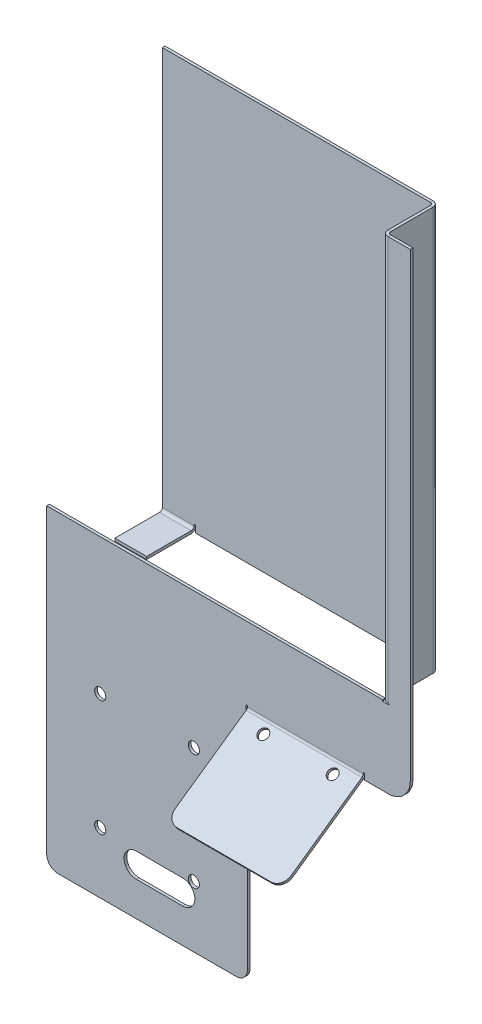
from build123d import *

# Parameters (mm, degrees)
BASE_FLANGE1_DEPTH            = 1.21412
SKETCH19_W                    = 150.565156201
SKETCH19_H                    = 181.162980563
CUT_EXTRUDE2_DEPTH            = 5
EDGE_FLANGE5_START            = 106.282964216
EDGE_FLANGE5_DEPTH            = 181.770040563
EDGE_FLANGE5_2_DEPTH          = 0.60706
EDGE_FLANGE5_START_2          = 106.890024216
EDGE_FLANGE5_3_DEPTH          = 181.162980563
EDGE_FLANGE6_STRIP_W          = 7.39648
EDGE_FLANGE6_STRIP_H          = 1.21412
EDGE_FLANGE6_STRIP_CUT_DEPTH  = 181.162980563
EDGE_FLANGE6_DEPTH            = 181.162980563
EDGE_FLANGE7_STRIP_W          = 7.39648
EDGE_FLANGE7_STRIP_H          = 1.21412
EDGE_FLANGE7_STRIP_CUT_DEPTH  = 14.216886025
EDGE_FLANGE7_RELIEF_W         = 8.00354
EDGE_FLANGE7_RELIEF_H         = 0.60706
EDGE_FLANGE7_RELIEF_CUT_DEPTH = 1.21412
EDGE_FLANGE7_DEPTH            = 14.216886025
SKETCH29_R                    = 2.5
CUT_EXTRUDE3_DEPTH            = 5
EDGE_FLANGE8_START            = -92.476413081
EDGE_FLANGE8_DEPTH            = 53.21412
EDGE_FLANGE8_2_DEPTH          = 0.60706
EDGE_FLANGE8_START_2          = -39.869353081
EDGE_FLANGE8_3_DEPTH          = 0.60706
EDGE_FLANGE8_START_3          = -91.869353081
EDGE_FLANGE8_4_DEPTH          = 52
EDGE_FLANGE8_START_4          = 58
EDGE_FLANGE8_5_DEPTH          = 2.895111402
SKETCH34_R                    = 2.25
CUT_EXTRUDE6_DEPTH            = 10


with BuildPart() as part:
    # Base-Flange1: sheet metal written as solids
    # Sketch1 → Base-Flange1 (new body)
    with BuildSketch(Plane.XY):
        with BuildLine():
            Line((-96.869353081, -33.474110531), (-176.869353081, -33.474110531))
            ThreePointArc((-176.869353081, -33.474110531), (-180.404886987, -32.009644437), (-181.869353081, -28.474110531))
            Line((-181.869353081, -28.474110531), (-181.869353081, 288.053004779))
            Line((-181.869353081, 288.053004779), (-18.770502539, 288.053004779))
            Line((-18.770502539, 288.053004779), (-18.770502539, 81.588857582))
            ThreePointArc((-18.770502539, 81.588857582), (-21.699434728, 74.51778977), (-28.770502539, 71.588857582))
            Line((-28.770502539, 71.588857582), (-91.869353081, 71.588857582))
            Line((-91.869353081, 71.588857582), (-91.869353081, -28.474110531))
            ThreePointArc((-91.869353081, -28.474110531), (-93.333819175, -32.009644437), (-96.869353081, -33.474110531))
        make_face()
    extrude(amount=-BASE_FLANGE1_DEPTH)

    # Sketch19 → Cut-Extrude2 (cut)
    with BuildSketch(Plane(origin=(0, 0, -1.21412), x_dir=(-1, 0, 0), z_dir=(0, 0, -1))):
        with Locations((106.586774981, 197.471514497)):
            Rectangle(SKETCH19_W, SKETCH19_H)
    extrude(amount=-CUT_EXTRUDE2_DEPTH, mode=Mode.SUBTRACT)

    # Edge-Flange5: read off the stored shape, not the designer's step
    # Edge-Flange5 outline → Edge-Flange5 (cut)
    with BuildSketch(Plane(origin=(0, 0, 0), x_dir=(1, 0, 0), z_dir=(0, 1, 0)).offset(EDGE_FLANGE5_START)):
        with BuildLine():
            Line((-31.30419688, 0), (-28.82007688, 0))
            ThreePointArc((-28.82007688, 0), (-30.04808742, 0.324758454), (-30.955012985, 1.21412))
            Line((-30.955012985, 1.21412), (-31.30419688, 1.21412))
            Line((-31.30419688, 1.21412), (-31.30419688, 0))
        make_face()
    extrude(amount=EDGE_FLANGE5_DEPTH, mode=Mode.SUBTRACT)

    # Edge-Flange5 2 outline → Edge-Flange5 2 (cut)
    with BuildSketch(Plane(origin=(0, 0, 0), x_dir=(1, 0, 0), z_dir=(0, 1, 0)).offset(EDGE_FLANGE5_START)):
        with BuildLine():
            Line((-28.21301688, 0), (-28.21301688, 1.21412))
            Line((-28.21301688, 1.21412), (-30.955012985, 1.21412))
            ThreePointArc((-30.955012985, 1.21412), (-30.04808742, 0.324758454), (-28.82007688, 0))
            Line((-28.82007688, 0), (-28.21301688, 0))
        make_face()
    extrude(amount=EDGE_FLANGE5_2_DEPTH, mode=Mode.SUBTRACT)

    # Edge-Flange5 3 outline → Edge-Flange5 3 (add)
    with BuildSketch(Plane(origin=(0, 0, 0), x_dir=(1, 0, 0), z_dir=(0, 1, 0)).offset(EDGE_FLANGE5_START_2)):
        with BuildLine():
            Line((-30.955012985, 1.21412), (-28.82007688, 1.21412))
            ThreePointArc((-28.82007688, 1.21412), (-29.718102492, 1.586094388), (-30.09007688, 2.48412))
            Line((-30.09007688, 2.48412), (-30.09007688, 24))
            Line((-30.09007688, 24), (-31.30419688, 24))
            Line((-31.30419688, 24), (-31.30419688, 2.48412))
            ThreePointArc((-31.30419688, 2.48412), (-31.215310653, 1.825555388), (-30.955012985, 1.21412))
        make_face()
    extrude(amount=EDGE_FLANGE5_3_DEPTH)

    # Edge-Flange6: sheet metal written as solids
    # Edge-Flange6 strip (on a plane across the edge) → Edge-Flange6 strip cut (cut)
    with BuildSketch(Plane(origin=(-31.30419688, 288.053004779, -24), x_dir=(0, 0, 1), z_dir=(0, -1, 0))):
        with Locations((-1.21412, -0.60706)):
            Rectangle(EDGE_FLANGE6_STRIP_W, EDGE_FLANGE6_STRIP_H)
    extrude(amount=EDGE_FLANGE6_STRIP_CUT_DEPTH, mode=Mode.SUBTRACT)

    # Edge-Flange6 section (on a plane across the edge) → Edge-Flange6 (add)
    with BuildSketch(Plane(origin=(-31.30419688, 288.053004779, -24), x_dir=(0, 0, 1), z_dir=(0, -1, 0))):
        with BuildLine():
            Line((0, 1.27), (0, 121.48412))
            Line((0, 121.48412), (1.21412, 121.48412))
            Line((1.21412, 121.48412), (1.21412, 1.27))
            ThreePointArc((1.21412, 1.27), (1.586094388, 0.371974388), (2.48412, 0))
            Line((2.48412, 0), (2.48412, -1.21412))
            ThreePointArc((2.48412, -1.21412), (0.727581903, -0.486538097), (0, 1.27))
        make_face()
    extrude(amount=EDGE_FLANGE6_DEPTH)

    # Edge-Flange7: sheet metal written as solids
    # Edge-Flange7 strip (on a plane across the edge) → Edge-Flange7 strip cut (cut)
    with BuildSketch(Plane(origin=(-152.78831688, 106.890024216, -22.78588), x_dir=(0, 1, 0), z_dir=(1, 0, 0))):
        with Locations((-1.21412, -0.60706)):
            Rectangle(EDGE_FLANGE7_STRIP_W, EDGE_FLANGE7_STRIP_H)
    extrude(amount=EDGE_FLANGE7_STRIP_CUT_DEPTH, mode=Mode.SUBTRACT)

    # Edge-Flange7 relief (on the sheet) → Edge-Flange7 relief cut (cut)
    with BuildSketch(Plane(origin=(-152.78831688, 109.374144216, -22.78588), x_dir=(0, 1, 0), z_dir=(0, 0, 1))):
        with Locations((-3.39471, -14.520416025)):
            Rectangle(EDGE_FLANGE7_RELIEF_W, EDGE_FLANGE7_RELIEF_H)
    extrude(amount=-EDGE_FLANGE7_RELIEF_CUT_DEPTH, mode=Mode.SUBTRACT)

    # Edge-Flange7 section (on a plane across the edge) → Edge-Flange7 (add)
    with BuildSketch(Plane(origin=(-152.78831688, 106.890024216, -22.78588), x_dir=(0, 1, 0), z_dir=(1, 0, 0))):
        with BuildLine():
            Line((0, 1.27), (0, 21.28588))
            Line((0, 21.28588), (1.21412, 21.28588))
            Line((1.21412, 21.28588), (1.21412, 1.27))
            ThreePointArc((1.21412, 1.27), (1.586094388, 0.371974388), (2.48412, 0))
            Line((2.48412, 0), (2.48412, -1.21412))
            ThreePointArc((2.48412, -1.21412), (0.727581903, -0.486538097), (0, 1.27))
        make_face()
    extrude(amount=EDGE_FLANGE7_DEPTH)

    # Sketch29 → Cut-Extrude3 (cut)
    with BuildSketch(Plane.XY):
        with Locations((-157.869353081, 45.8541873)):
            Circle(SKETCH29_R)
        with Locations((-115.869353081, 45.8541873)):
            Circle(SKETCH29_R)
        with Locations((-157.869353081, -6.1458127)):
            Circle(SKETCH29_R)
        with Locations((-115.869353081, -6.1458127)):
            Circle(SKETCH29_R)
        with BuildLine():
            Line((-120.869353081, -18.100802087), (-141.694922457, -18.100802087))
            ThreePointArc((-141.694922457, -18.100802087), (-147.149911844, -12.6458127), (-141.694922457, -7.190823313))
            Line((-141.694922457, -7.190823313), (-120.869353081, -7.190823313))
            ThreePointArc((-120.869353081, -7.190823313), (-115.414363694, -12.6458127), (-120.869353081, -18.100802087))
        make_face()
    extrude(amount=-CUT_EXTRUDE3_DEPTH, mode=Mode.SUBTRACT)

    # Edge-Flange8: read off the stored shape, not the designer's step
    # Edge-Flange8 outline → Edge-Flange8 (cut)
    with BuildSketch(Plane.YZ.offset(EDGE_FLANGE8_START)):
        with BuildLine():
            Line((71.588857582, -1.21412), (73.732144579, -1.21412))
            ThreePointArc((73.732144579, -1.21412), (72.585105614, -0.933441351), (71.697272603, -0.154832697))
            Line((71.697272603, -0.154832697), (71.588857582, 0))
            Line((71.588857582, 0), (71.588857582, -1.21412))
        make_face()
    extrude(amount=EDGE_FLANGE8_DEPTH, mode=Mode.SUBTRACT)

    # Edge-Flange8 2 outline → Edge-Flange8 2 (cut)
    with BuildSketch(Plane.YZ.offset(EDGE_FLANGE8_START)):
        with BuildLine():
            Line((74.339204579, -1.21412), (74.339204579, 0))
            Line((74.339204579, 0), (71.588857582, 0))
            Line((71.588857582, 0), (71.697272603, -0.154832697))
            ThreePointArc((71.697272603, -0.154832697), (72.585105614, -0.933441351), (73.732144579, -1.21412))
            Line((73.732144579, -1.21412), (74.339204579, -1.21412))
        make_face()
    extrude(amount=EDGE_FLANGE8_2_DEPTH, mode=Mode.SUBTRACT)

    # Edge-Flange8 3 outline → Edge-Flange8 3 (cut)
    with BuildSketch(Plane.YZ.offset(EDGE_FLANGE8_START_2)):
        with BuildLine():
            Line((74.339204579, -1.21412), (74.339204579, 0))
            Line((74.339204579, 0), (71.588857582, 0))
            Line((71.588857582, 0), (71.697272603, -0.154832697))
            ThreePointArc((71.697272603, -0.154832697), (72.585105614, -0.933441351), (73.732144579, -1.21412))
            Line((73.732144579, -1.21412), (74.339204579, -1.21412))
        make_face()
    extrude(amount=EDGE_FLANGE8_3_DEPTH, mode=Mode.SUBTRACT)

    # Edge-Flange8 4 outline → Edge-Flange8 4 (add)
    with BuildSketch(Plane.YZ.offset(EDGE_FLANGE8_START_3)):
        with BuildLine():
            Line((71.588857582, 0), (73.732144579, 0))
            ThreePointArc((73.732144579, 0), (73.14572384, 0.143496242), (72.691821483, 0.541557926))
            Line((72.691821483, 0.541557926), (47.529257546, 36.477423457))
            Line((47.529257546, 36.477423457), (46.534708666, 35.781032834))
            Line((46.534708666, 35.781032834), (71.588857582, 0))
        make_face()
    extrude(amount=EDGE_FLANGE8_4_DEPTH)

    # Edge-Flange8 5 outline → Edge-Flange8 5 (cut)
    with BuildSketch(Plane(origin=(0, 0, 0), x_dir=(1, 0, 0), z_dir=(0, 0.8191520442889886, 0.5735764363510508)).offset(EDGE_FLANGE8_START_4)):
        with BuildLine():
            ThreePointArc((-39.869353081, 2.381106171), (-41.333819175, -1.154427735), (-44.869353081, -2.618893829))
            Line((-44.869353081, -2.618893829), (-39.869353081, -2.61889383))
            Line((-39.869353081, -2.61889383), (-39.869353081, 2.381106171))
        make_face()
        with BuildLine():
            Line((-91.869353081, -2.61889383), (-86.869353081, -2.618893829))
            ThreePointArc((-86.869353081, -2.618893829), (-90.404886987, -1.154427735), (-91.869353081, 2.381106171))
            Line((-91.869353081, 2.381106171), (-91.869353081, -2.61889383))
        make_face()
    extrude(amount=EDGE_FLANGE8_5_DEPTH, mode=Mode.SUBTRACT)

    # Sketch34 → Cut-Extrude6 (cut)
    with BuildSketch(Plane(origin=(0, 49.031393336, 34.332151223), x_dir=(1, 0, 0), z_dir=(0, 0.8191520442889887, 0.5735764363510506))):
        with Locations(Location((-80.981806948, 37.381106171, 0), (0, 0, 270))):
            Circle(SKETCH34_R)
        with Locations(Location((-49.861806948, 37.381106171, 0), (0, 0, 270))):
            Circle(SKETCH34_R)
    extrude(amount=-CUT_EXTRUDE6_DEPTH, mode=Mode.SUBTRACT)


solid = part.part
